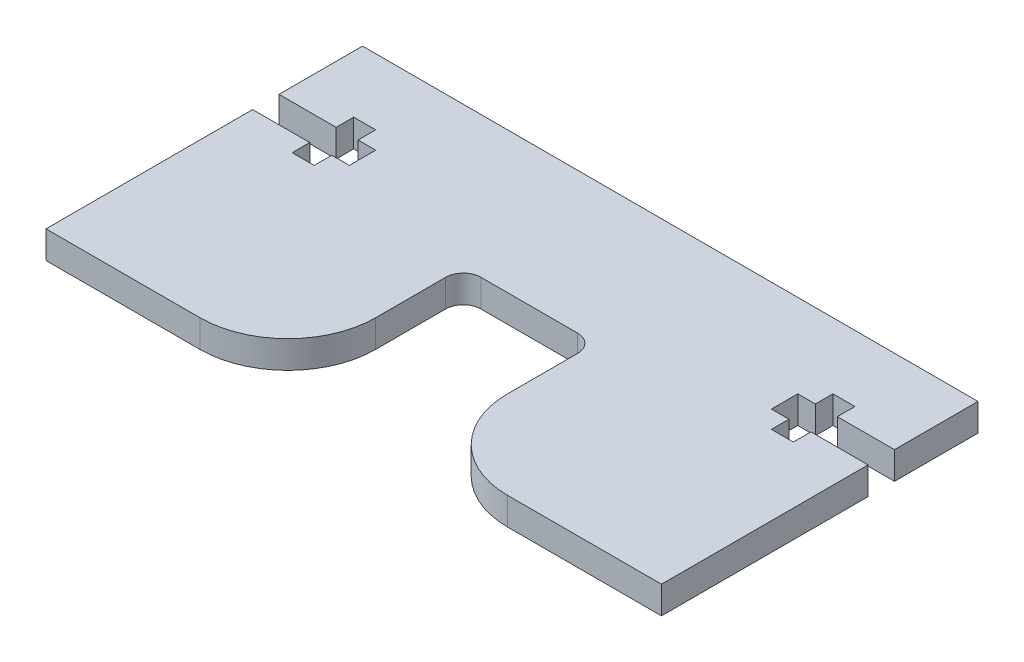
from build123d import *

# Parameters (mm, degrees)
BOSS_EXTRUDE1_DEPTH = 1.5625
SKETCH2_W           = 15
SKETCH2_H           = 19.9625
CUT_EXTRUDE1_DEPTH  = 51.306715506
FILLET1_R           = 10
FILLET2_R           = 2


with BuildPart() as part:
    # Sketch1 → Boss-Extrude1 (new, symmetric)
    with BuildSketch(Plane(origin=(0, 0, 0), x_dir=(1, 0, 0), z_dir=(0, 1, 0))):
        Polygon((0, 36), (35, 36), (35, 26.5), (28.5, 26.5), (28.5, 28.5), (26, 28.5), (26, 26.5), (24, 26.5), (24, 23.5), (26, 23.5), (26, 21.5), (28.5, 21.5), (28.5, 23.5), (35, 23.5), (35, 0), (0, 0), align=None)
    boss_extrude1 = extrude(amount=BOSS_EXTRUDE1_DEPTH, both=True)

    # Mirror1: Boss-Extrude1 across plane
    add(boss_extrude1.mirror(Plane(origin=(0, 0, 0), x_dir=(0, 0, 1), z_dir=(1, 0, 0))))

    # Sketch2 → Cut-Extrude1 (cut, through all)
    with BuildSketch(Plane.XZ.offset(1.5625)):
        with Locations((0, -9.98125)):
            Rectangle(SKETCH2_W, SKETCH2_H)
    extrude(amount=-CUT_EXTRUDE1_DEPTH, mode=Mode.SUBTRACT)

    # Fillet1
    fillet1_edges = [part.edges().sort_by_distance(p)[0] for p in [
        (-7.5, 0, 0),
        (7.5, 0, 0),
    ]]
    fillet(fillet1_edges, radius=FILLET1_R)

    # Fillet2
    fillet2_edges = [part.edges().sort_by_distance(p)[0] for p in [
        (7.5, 0, -19.9625),
        (-7.5, 0, -19.9625),
    ]]
    fillet(fillet2_edges, radius=FILLET2_R)


solid = part.part
